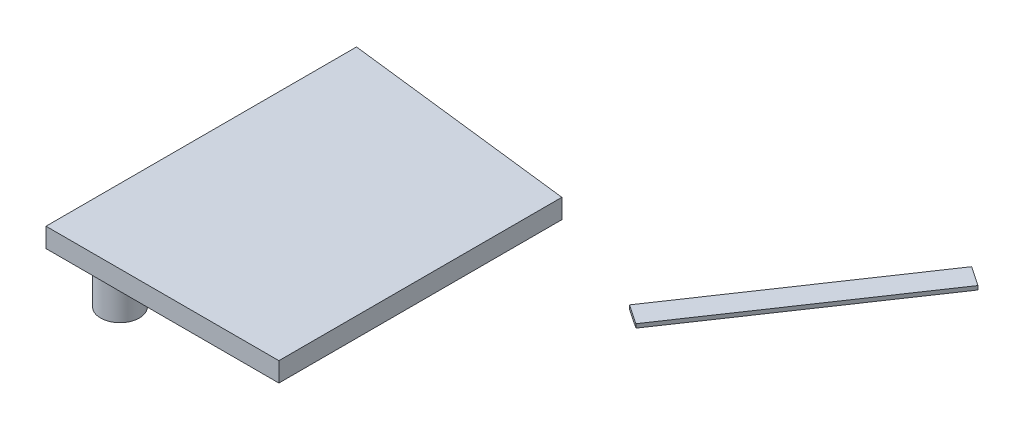
from build123d import *

# Parameters (mm, degrees)
TOPPAD_DEPTH    = 5
SKETCH13_R      = 4.996295261
STAND_DEPTH     = 15
BOTTOMPAD_DEPTH = 1


with BuildPart() as part:
    # Sketch12 → TopPad (new body)
    with BuildSketch(Plane(origin=(0, 0, 0), x_dir=(1, 0, 0), z_dir=(0, 1, 0))):
        Polygon((-1096.671779822, 169.837721258), (-1096.671779822, 242.740317715), (-1156.671779822, 249.837721258), (-1156.671779822, 169.837721258), align=None)
    extrude(amount=TOPPAD_DEPTH)

    # Sketch13 → Stand (add)
    with BuildSketch(Plane.XZ):
        with Locations((-1149.142405583, -181.363625231)):
            Circle(SKETCH13_R)
    extrude(amount=STAND_DEPTH)


with BuildPart() as body_2:
    # Sketch14 → BottomPad (new body)
    with BuildSketch(Plane.XZ.offset(15)):
        Polygon((-1083.944080763, -247.466457354), (-1048.393603831, -300.05480011), (-1043.377956761, -296.66415047), (-1078.928433693, -244.075807713), align=None)
    extrude(amount=BOTTOMPAD_DEPTH)


solid = Compound([part.part, body_2.part])
